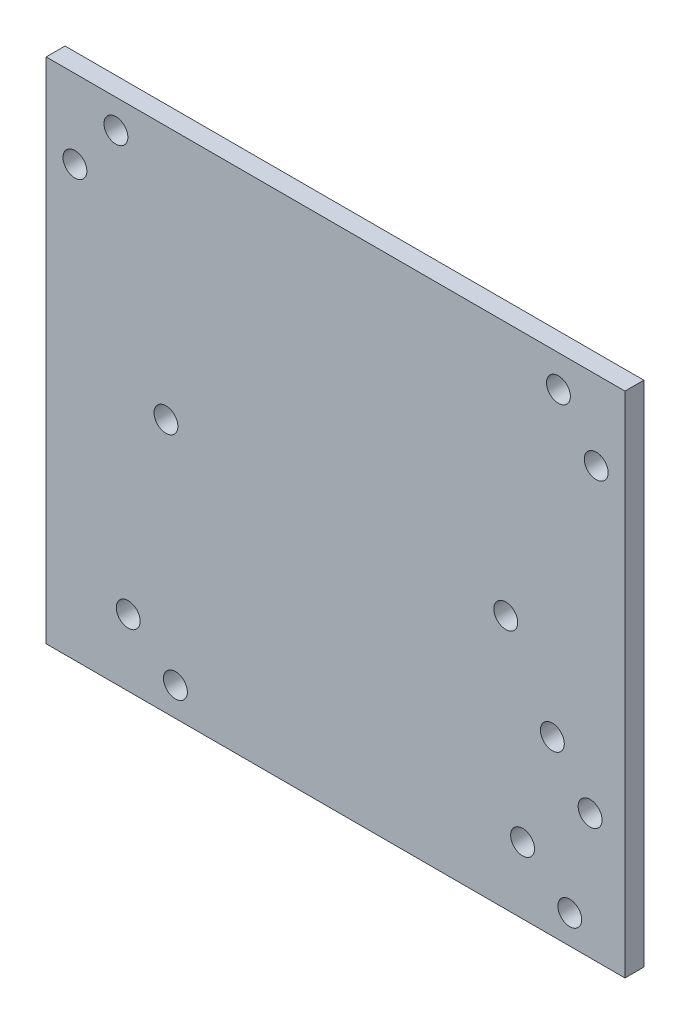
from build123d import *

# Parameters (mm, degrees)
SKETCH1_W           = 194.673052653
SKETCH1_H           = 170.954941939
SKETCH1_R           = 4.0127
SKETCH1_R_2         = 4.0254
BOSS_EXTRUDE1_DEPTH = 6.35


with BuildPart() as part:
    # Sketch1 → Boss-Extrude1 (new body)
    with BuildSketch(Plane.XY):
        with Locations((959.381316203, 302.755736555)):
            Rectangle(SKETCH1_W, SKETCH1_H)
        with Locations((1022.279959413, 239.653265586)):
            Circle(SKETCH1_R, mode=Mode.SUBTRACT)
        with Locations((1038.154959413, 226.953265586)):
            Circle(SKETCH1_R, mode=Mode.SUBTRACT)
        with Locations((889.644786871, 239.653265586)):
            Circle(SKETCH1_R, mode=Mode.SUBTRACT)
        with Locations((1034.333859926, 377.480941448)):
            Circle(SKETCH1_R, mode=Mode.SUBTRACT)
        with Locations((1047.042842529, 361.613131701)):
            Circle(SKETCH1_R, mode=Mode.SUBTRACT)
        with Locations((871.719789876, 361.793284425)):
            Circle(SKETCH1_R, mode=Mode.SUBTRACT)
        with Locations((885.505258454, 378.558207525)):
            Circle(SKETCH1_R, mode=Mode.SUBTRACT)
        with Locations((905.519786871, 226.953265586)):
            Circle(SKETCH1_R, mode=Mode.SUBTRACT)
        with Locations((902.338636269, 302.755736555)):
            Circle(SKETCH1_R, mode=Mode.SUBTRACT)
        with Locations((1016.638636269, 302.755736555)):
            Circle(SKETCH1_R, mode=Mode.SUBTRACT)
        with Locations((1032.286575074, 275.289465586)):
            Circle(SKETCH1_R_2, mode=Mode.SUBTRACT)
        with Locations((1044.986575074, 259.414465586)):
            Circle(SKETCH1_R_2, mode=Mode.SUBTRACT)
    extrude(amount=BOSS_EXTRUDE1_DEPTH)


solid = part.part
